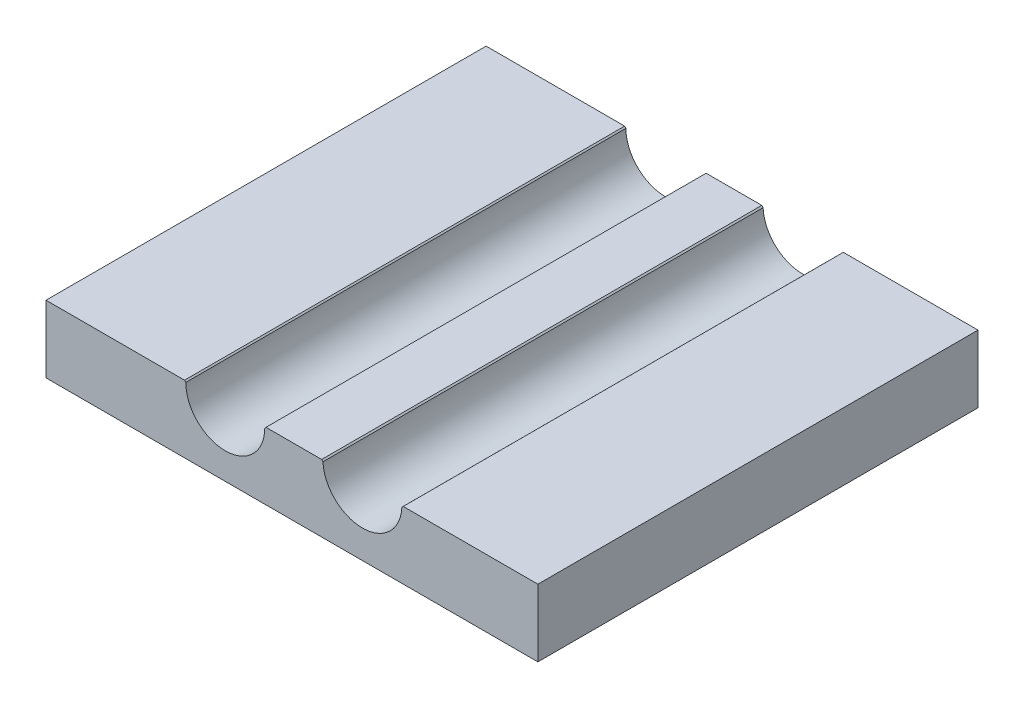
from build123d import *

# Parameters (mm, degrees)
SKETCH1_W           = 38
SKETCH1_H           = 34
BOSS_EXTRUDE1_DEPTH = 2
BOSS_EXTRUDE2_DEPTH = 34
CHAMFER1_SIZE       = 0.1
CHAMFER1_SIZE_2     = 0.100939666
CHAMFER1_SIZE_3     = 0.096996068


with BuildPart() as part:
    # Sketch1 → Boss-Extrude1 (new body)
    with BuildSketch(Plane(origin=(0, 0, 0), x_dir=(1, 0, 0), z_dir=(0, 1, 0))):
        Rectangle(SKETCH1_W, SKETCH1_H)
    extrude(amount=BOSS_EXTRUDE1_DEPTH)

    # Sketch2 → Boss-Extrude2 (add, through all)
    with BuildSketch(Plane.XY.offset(17)):
        with BuildLine():
            Line((-2.101169585, 5.192456713), (2.394541693, 5.192456713))
            ThreePointArc((2.394541693, 5.192456713), (5.447861319, 2.177768465), (8.494206352, 5.199504374))
            Line((8.494206352, 5.199504374), (19, 5.199504374))
            Line((19, 5.199504374), (19, 1.662378765))
            Line((19, 1.662378765), (-19, 1.662378765))
            Line((-19, 1.662378765), (-19, 5.198537403))
            Line((-19, 5.198537403), (-8.197951747, 5.198537403))
            ThreePointArc((-8.197951747, 5.198537403), (-5.152701361, 2.046490686), (-2.101169585, 5.192456713))
        make_face()
    extrude(amount=-BOSS_EXTRUDE2_DEPTH)

    # Chamfer1
    # the kernel refuses this chamfer: 0.101178115, 0.100939666, 0.1, 0.096996068, 0.096814929 mm, written as the material it takes off along each edge
    with BuildSketch(Plane(origin=(2.394541693, 5.192456713, 17.264875528), x_dir=(0.028454787424249305, -0.9995950805564424, 0), z_dir=(0, 0, -1))) as chamfer1_piece_1:
        with BuildLine():
            Line((0.102971734, 0), (-CHAMFER1_SIZE * 0.0284547874242, CHAMFER1_SIZE * 0.999595080556))
            Line((-CHAMFER1_SIZE * 0.0284547874242, CHAMFER1_SIZE * 0.999595080556), (0, 0))
            ThreePointArc((0, 0), (0.052957758, 0.000434232), (0.102971734, 0))
        make_face()
    extrude(amount=34.529751055, mode=Mode.SUBTRACT)
    with BuildSketch(Plane(origin=(8.494206352, 5.199504374, 17.261624735), x_dir=(1, 0, 0), z_dir=(0, 0, -1))) as chamfer1_piece_2:
        with BuildLine():
            Line((CHAMFER1_SIZE_2 * 0.999999995384, 0), (-0.002638157, 0.10167581))
            ThreePointArc((-0.002638157, 0.10167581), (-0.000933226, 0.052300381), (0, 0))
            Line((0, 0), (CHAMFER1_SIZE_2 * 0.999999995384, 0))
        make_face()
    extrude(amount=34.52324947, mode=Mode.SUBTRACT)
    with BuildSketch(Plane(origin=(-8.197951747, 5.198537403, 17.257168299), x_dir=(-0.017346814306717553, -0.9998495326964995, 0), z_dir=(0, 0, -1))) as chamfer1_piece_3:
        with BuildLine():
            Line((0.098309437, 0), (CHAMFER1_SIZE * 0.0173468143067, CHAMFER1_SIZE * 0.999849532696))
            Line((CHAMFER1_SIZE * 0.0173468143067, CHAMFER1_SIZE * 0.999849532696), (0, 0))
            ThreePointArc((0, 0), (0.050545023, 0.000395805), (0.098309437, 0))
        make_face()
    extrude(amount=34.514336598, mode=Mode.SUBTRACT)
    with BuildSketch(Plane(origin=(-2.101169585, 5.192456713, 17.261555472), x_dir=(1, 0, 0), z_dir=(0, 0, -1))) as chamfer1_piece_4:
        with BuildLine():
            Line((CHAMFER1_SIZE_3 * 0.999999996404, 0), (0.001504787, 0.101698897))
            ThreePointArc((0.001504787, 0.101698897), (0.001197292, 0.052281476), (0, 0))
            Line((0, 0), (CHAMFER1_SIZE_3 * 0.999999996404, 0))
        make_face()
    extrude(amount=34.523110943, mode=Mode.SUBTRACT)


solid = part.part
